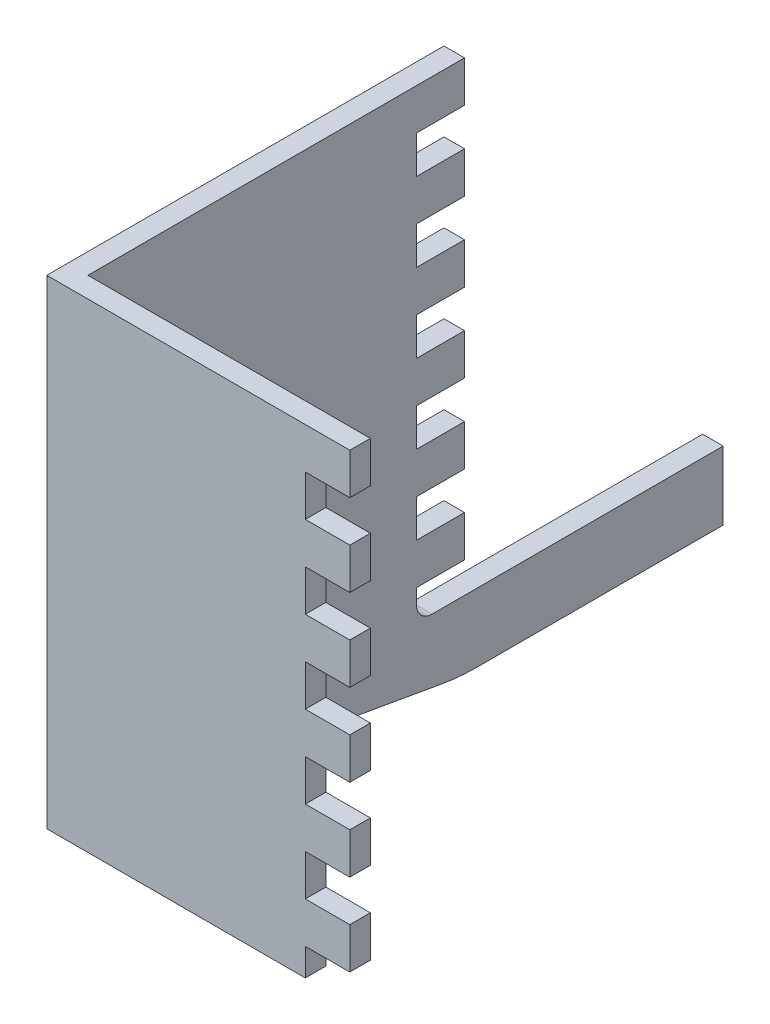
from build123d import *

# Parameters (mm, degrees)
CROQUIS1_W                 = 37.75
CROQUIS1_H                 = 70
SALIENTE_EXTRUIR1_DEPTH    = 3
CROQUIS2_W                 = 3
CROQUIS2_H                 = 70
SALIENTE_EXTRUIR2_DEPTH    = 30
CROQUIS3_W                 = 3
CROQUIS3_H                 = 6
SALIENTE_EXTRUIR3_DEPTH    = 6.5
CROQUIS4_W                 = 25
CROQUIS4_H                 = 70
SALIENTE_EXTRUIR5_DEPTH    = 3
CROQUIS5_W                 = 3
CROQUIS5_H                 = 5.5
CORTAR_EXTRUIR1_DEPTH      = 7
SALIENTE_EXTRUIR6_DEPTH    = 3
CORTAR_EXTRUIR2_DEPTH      = 112.412559576
CORTAR_EXTRUIR2_DEPTH_BACK = 112.412559576


with BuildPart() as part:
    # Croquis1 → Saliente-Extruir1 (new body)
    with BuildSketch(Plane.XY):
        Rectangle(CROQUIS1_W, CROQUIS1_H)
    extrude(amount=SALIENTE_EXTRUIR1_DEPTH)

    # Croquis2 → Saliente-Extruir2 (add)
    with BuildSketch(Plane(origin=(0, 0, 0), x_dir=(-1, 0, 0), z_dir=(0, 0, -1))):
        with Locations((17.375, 0)):
            Rectangle(CROQUIS2_W, CROQUIS2_H)
    extrude(amount=SALIENTE_EXTRUIR2_DEPTH)

    # Croquis3 → Saliente-Extruir3 (add)
    with BuildSketch(Plane(origin=(18.875, 0, 0), x_dir=(0, 0, -1), z_dir=(1, 0, 0))):
        with Locations((-1.5, 20)):
            Rectangle(CROQUIS3_W, CROQUIS3_H)
        with Locations((-1.5, 32)):
            Rectangle(CROQUIS3_W, CROQUIS3_H)
        with Locations((-1.5, 8)):
            Rectangle(CROQUIS3_W, CROQUIS3_H)
        with Locations((-1.5, -4)):
            Rectangle(CROQUIS3_W, CROQUIS3_H)
        with Locations((-1.5, -16)):
            Rectangle(CROQUIS3_W, CROQUIS3_H)
        with Locations((-1.5, -28)):
            Rectangle(CROQUIS3_W, CROQUIS3_H)
    extrude(amount=SALIENTE_EXTRUIR3_DEPTH)

    # Croquis4 → Saliente-Extruir5 (add)
    with BuildSketch(Plane(origin=(-15.875, 0, 0), x_dir=(0, 0, -1), z_dir=(1, 0, 0))):
        with Locations((42.5, 0)):
            Rectangle(CROQUIS4_W, CROQUIS4_H)
    extrude(amount=-SALIENTE_EXTRUIR5_DEPTH)

    # Croquis5 → Cortar-Extruir1 (cut)
    with BuildSketch(Plane(origin=(0, 0, -55), x_dir=(-1, 0, 0), z_dir=(0, 0, -1))):
        with Locations((17.375, 26.25)):
            Rectangle(CROQUIS5_W, CROQUIS5_H)
        with Locations((17.375, 14.75)):
            Rectangle(CROQUIS5_W, CROQUIS5_H)
        with Locations((17.375, 3.25)):
            Rectangle(CROQUIS5_W, CROQUIS5_H)
        with Locations((17.375, -8.25)):
            Rectangle(CROQUIS5_W, CROQUIS5_H)
        with Locations((17.375, -19.75)):
            Rectangle(CROQUIS5_W, CROQUIS5_H)
    extrude(amount=-CORTAR_EXTRUIR1_DEPTH, mode=Mode.SUBTRACT)

    # Croquis7 → Saliente-Extruir6 (add)
    with BuildSketch(Plane.ZY.offset(18.875)):
        with BuildLine():
            Line((-9, -35), (-51.686221701, -42.52673259))
            ThreePointArc((-51.686221701, -42.52673259), (-54.280994748, -42.868340943), (-56.895667031, -42.9825))
            Line((-56.895667031, -42.9825), (-92.775, -42.9825))
            Line((-92.775, -42.9825), (-92.775, -32.9825))
            Line((-92.775, -32.9825), (-50.25, -32.9825))
            Line((-50.25, -32.9825), (-9, -35))
        make_face()
    extrude(amount=-SALIENTE_EXTRUIR6_DEPTH)

    # Croquis8 → Cortar-Extruir2 (cut, two sides: drawn at the far end of the back side and taken through both)
    with BuildSketch(Plane.ZY.offset(18.875).offset(-CORTAR_EXTRUIR2_DEPTH_BACK)):
        with BuildLine():
            Line((-48, -28.5), (-48, -30.7325))
            ThreePointArc((-48, -30.7325), (-48.659009742, -32.323490258), (-50.25, -32.9825))
            Line((-50.25, -32.9825), (-92.775, -32.9825))
            Line((-92.775, -32.9825), (-92.775, -28.5))
            Line((-92.775, -28.5), (-48, -28.5))
        make_face()
    extrude(amount=CORTAR_EXTRUIR2_DEPTH + CORTAR_EXTRUIR2_DEPTH_BACK, mode=Mode.SUBTRACT)


solid = part.part
